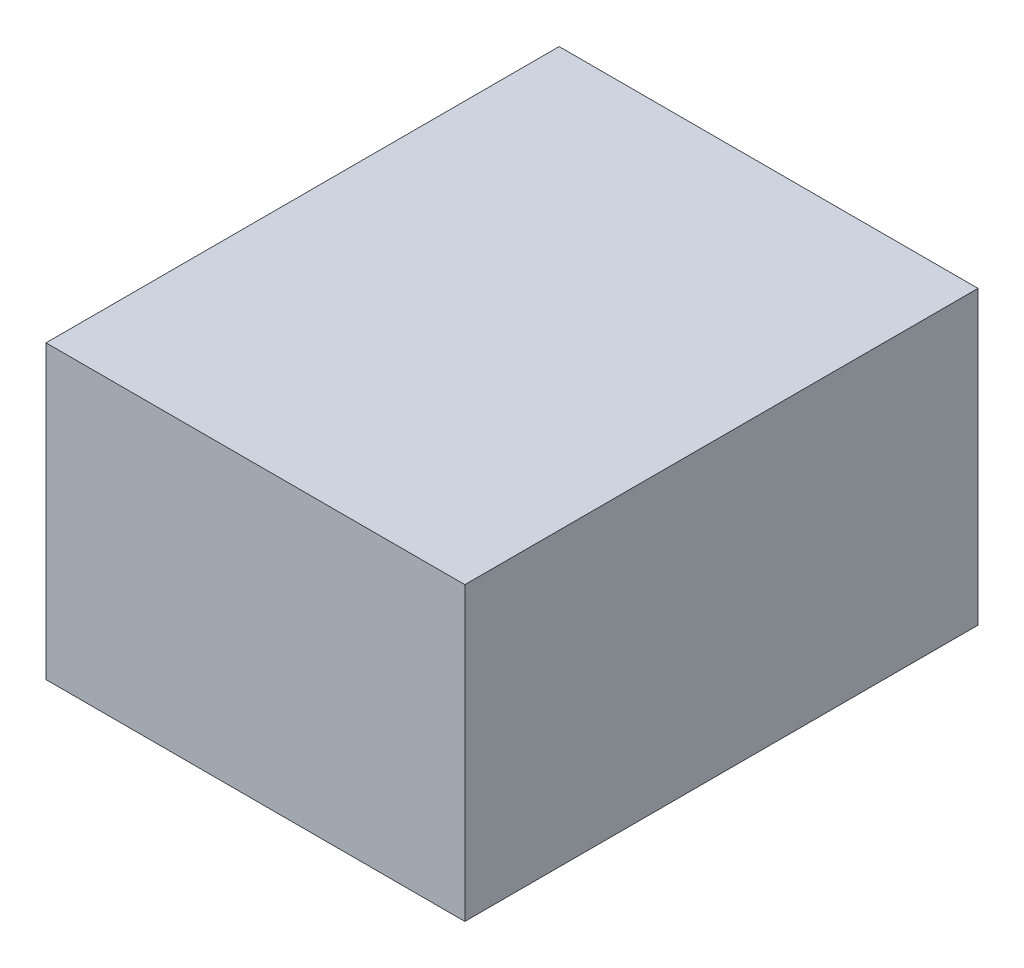
from build123d import *

# Parameters (mm, degrees)
SKETCH1_W           = 19.1
SKETCH1_H           = 23.4
BOSS_EXTRUDE1_DEPTH = 13.3


with BuildPart() as part:
    # Sketch1 → Boss-Extrude1 (new body)
    with BuildSketch(Plane(origin=(0, 0, 0), x_dir=(1, 0, 0), z_dir=(0, 1, 0))):
        Rectangle(SKETCH1_W, SKETCH1_H)
    extrude(amount=BOSS_EXTRUDE1_DEPTH)


solid = part.part
